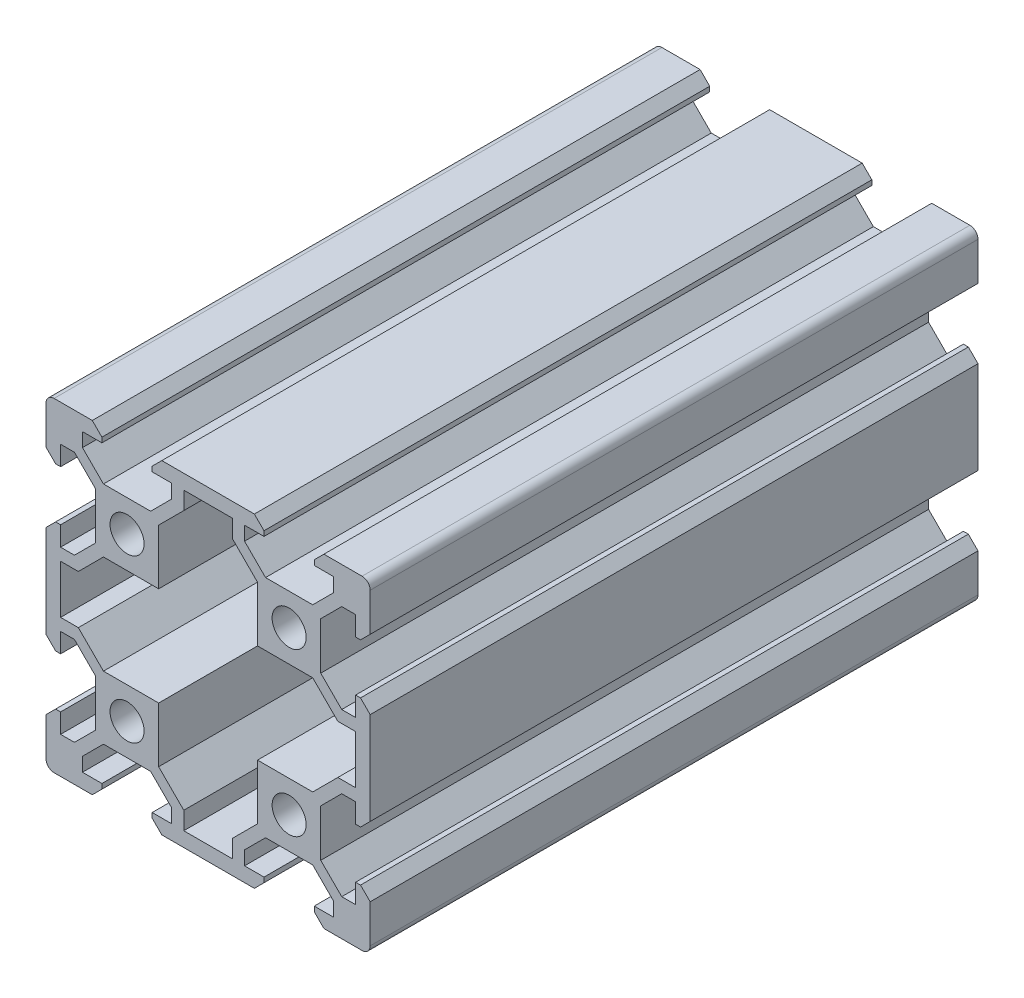
from build123d import *

# Parameters (mm, degrees)
SKETCH_1_R      = 2.1
EXTRUDE_1_DEPTH = 75
VERRUNDUNG1_R   = 1


with BuildPart() as part:
    # 草图1 → 凸台-拉伸1 (new body)
    with BuildSketch(Plane.XY):
        Polygon((5.71, 20), (-5.71, 20), (-6.9, 18.81), (-6.9, 18.2), (-4.5, 18.2), (-4.5, 16.489949494), (-7.089949494, 13.9), (-12.910050506, 13.9), (-15.5, 16.489949494), (-15.5, 18.2), (-13.1, 18.2), (-13.1, 18.81), (-14.29, 20), (-20, 20), (-20, 14.29), (-18.81, 13.1), (-18.2, 13.1), (-18.2, 15.5), (-16.489949494, 15.5), (-13.9, 12.910050506), (-13.9, 7.089949494), (-16.489949494, 4.5), (-18.2, 4.5), (-18.2, 6.9), (-18.81, 6.9), (-20, 5.71), (-20, -5.71), (-18.81, -6.9), (-18.2, -6.9), (-18.2, -4.5), (-16.489949494, -4.5), (-13.9, -7.089949494), (-13.9, -12.910050506), (-16.489949494, -15.5), (-18.2, -15.5), (-18.2, -13.1), (-18.81, -13.1), (-20, -14.29), (-20, -20), (-14.29, -20), (-13.1, -18.81), (-13.1, -18.2), (-15.5, -18.2), (-15.5, -16.489949494), (-12.910050506, -13.9), (-7.089949494, -13.9), (-4.5, -16.489949494), (-4.5, -18.2), (-6.9, -18.2), (-6.9, -18.81), (-5.71, -20), (5.71, -20), (6.9, -18.81), (6.9, -18.2), (4.5, -18.2), (4.5, -16.489949494), (7.089949494, -13.9), (12.910050506, -13.9), (15.5, -16.489949494), (15.5, -18.2), (13.1, -18.2), (13.1, -18.81), (14.29, -20), (20, -20), (20, -14.29), (18.81, -13.1), (18.2, -13.1), (18.2, -15.5), (16.489949494, -15.5), (13.9, -12.910050506), (13.9, -7.089949494), (16.489949494, -4.5), (18.2, -4.5), (18.2, -6.9), (18.81, -6.9), (20, -5.71), (20, 5.71), (18.81, 6.9), (18.2, 6.9), (18.2, 4.5), (16.489949494, 4.5), (13.9, 7.089949494), (13.9, 12.910050506), (16.489949494, 15.5), (18.2, 15.5), (18.2, 13.1), (18.81, 13.1), (20, 14.29), (20, 20), (14.29, 20), (13.1, 18.81), (13.1, 18.2), (15.5, 18.2), (15.5, 16.489949494), (12.910050506, 13.9), (7.089949494, 13.9), (4.5, 16.489949494), (4.5, 18.2), (6.9, 18.2), (6.9, 18.81), align=None)
        with Locations((-10, 10)):
            Circle(SKETCH_1_R, mode=Mode.SUBTRACT)
        with Locations((-10, -10)):
            Circle(SKETCH_1_R, mode=Mode.SUBTRACT)
        with Locations((10, -10)):
            Circle(SKETCH_1_R, mode=Mode.SUBTRACT)
        with Locations((10, 10)):
            Circle(SKETCH_1_R, mode=Mode.SUBTRACT)
        Polygon((-6.1, 6.1), (-6.1, 12.910050506), (-3, 16.010050506), (-3, 18.2), (3, 18.2), (3, 16.010050506), (6.1, 12.910050506), (6.1, 6.1), (12.910050506, 6.1), (16.010050506, 3), (18.2, 3), (18.2, -3), (16.010050506, -3), (12.910050506, -6.1), (6.1, -6.1), (6.1, -12.910050506), (3, -16.010050506), (3, -18.2), (-3, -18.2), (-3, -16.010050506), (-6.1, -12.910050506), (-6.1, -6.1), (-12.910050506, -6.1), (-16.010050506, -3), (-18.2, -3), (-18.2, 3), (-16.010050506, 3), (-12.910050506, 6.1), align=None, mode=Mode.SUBTRACT)
    extrude(amount=EXTRUDE_1_DEPTH)

    # Verrundung1
    verrundung1_edges = [part.edges().sort_by_distance(p)[0] for p in [
        (20, -20, 37.5),
        (-20, -20, 37.5),
        (-20, 20, 37.5),
        (20, 20, 37.5),
    ]]
    fillet(verrundung1_edges, radius=VERRUNDUNG1_R)


solid = part.part
